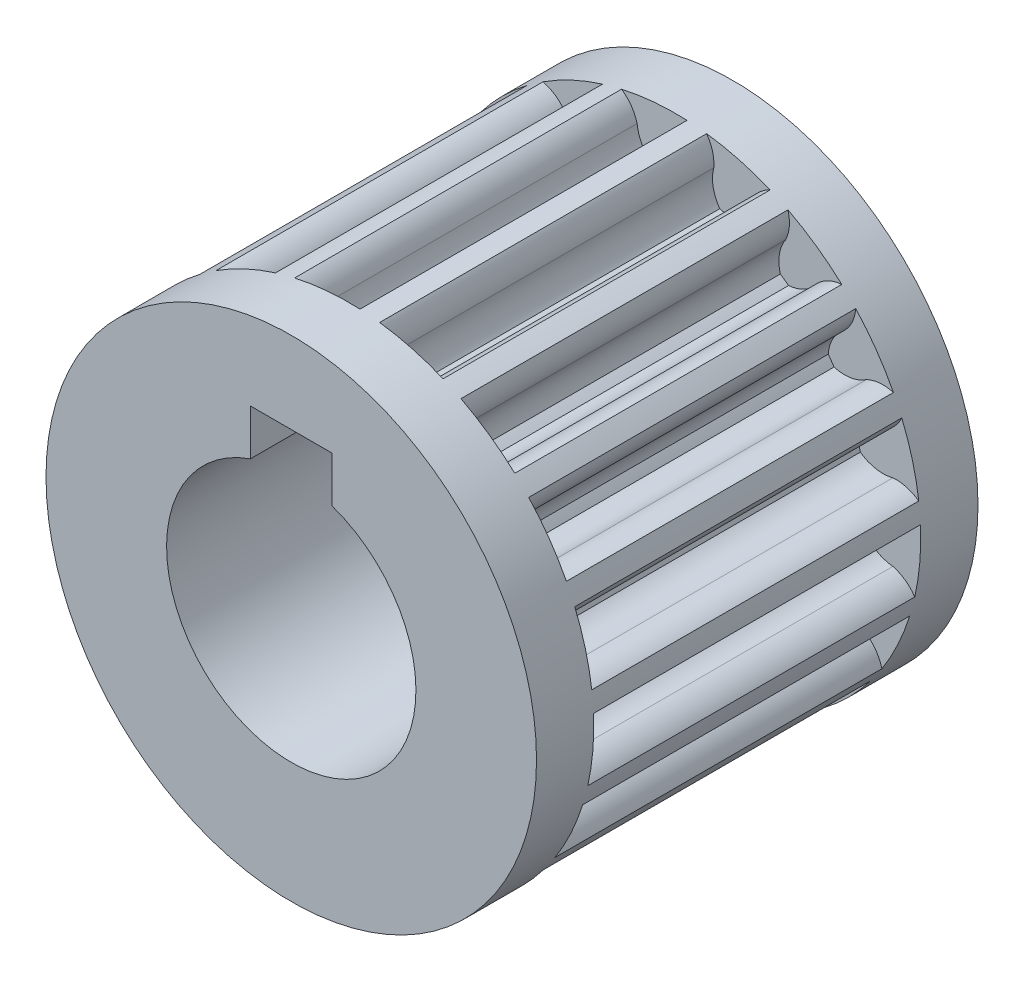
from build123d import *
from build123d.topology import SkipClean

# Parameters (mm, degrees)
CROQUIS1_R              = 15
SALIENTE_EXTRUIR1_DEPTH = 20
CORTAR_EXTRUIR1_START   = -50
CORTAR_EXTRUIR1_DEPTH   = 50
MATRIZC1_COUNT          = 18
CORTAR_EXTRUIR2_DEPTH   = 50
SALIENTE_EXTRUIR2_START = 3.5
CROQUIS4_R              = 15
SALIENTE_EXTRUIR2_DEPTH = 3.5
CROQUIS5_R              = 15
SALIENTE_EXTRUIR3_DEPTH = 3.5


with BuildPart() as part:
    # Croquis1 → Saliente-Extruir1 (new body)
    with BuildSketch(Plane.XY):
        Circle(CROQUIS1_R)
    extrude(amount=SALIENTE_EXTRUIR1_DEPTH)

    # Croquis2 → Cortar-Extruir1 (cut)
    with BuildSketch(Plane.XY.offset(20).offset(CORTAR_EXTRUIR1_START)):
        with BuildLine():
            ThreePointArc((0.706271711, -11.603525553), (0.13915994, -12.472075367), (0, -13.5))
            ThreePointArc((0, -13.5), (-0.21879275, -14.305081992), (-0.704430424, -14.983450129))
            ThreePointArc((-0.704430424, -14.983450129), (1.309, -14.942774809), (3.298836097, -14.632760519))
            ThreePointArc((3.298836097, -14.632760519), (2.702648979, -14.049161169), (2.347211067, -13.29438228))
            ThreePointArc((2.347211067, -13.29438228), (2.031447992, -12.306309297), (1.321961295, -11.549590613))
            ThreePointArc((1.321961295, -11.549590613), (1.014475, -11.580650477), (0.706271711, -11.603525553))
        make_face()
    cortar_extruir1 = extrude(amount=CORTAR_EXTRUIR1_DEPTH, mode=Mode.SUBTRACT)

    # MatrizC1: Cortar-Extruir1 ×18 about axis
    matrizc1_axis = Axis((0, 0, 20), (0, 0, 1))
    for i in range(1, MATRIZC1_COUNT):
        add(cortar_extruir1.rotate(matrizc1_axis, i * 360 / MATRIZC1_COUNT), mode=Mode.SUBTRACT)

    # Croquis3 → Cortar-Extruir2 (cut)
    with BuildSketch(Plane.XY.offset(20)):
        with BuildLine():
            Line((-2.5, 7.203514767), (-2.5, 10.005475737))
            Line((-2.5, 10.005475737), (2.5, 10.005475737))
            Line((2.5, 10.005475737), (2.5, 7.203514767))
            ThreePointArc((2.5, 7.203514767), (0, -7.625), (-2.5, 7.203514767))
        make_face()
    extrude(amount=-CORTAR_EXTRUIR2_DEPTH, mode=Mode.SUBTRACT)

    # Croquis4 → Saliente-Extruir2 (add)
    with SkipClean():  # the faces are left unmerged after this step: merging them gives an invalid solid
        with BuildSketch(Plane(origin=(0, 0, 0), x_dir=(-1, 0, 0), z_dir=(0, 0, -1)).offset(SALIENTE_EXTRUIR2_START)):
            Circle(CROQUIS4_R)
            with BuildLine():
                Line((2.5, 10.005475737), (2.5, 7.203514767))
                ThreePointArc((2.5, 7.203514767), (0, -7.625), (-2.5, 7.203514767))
                Line((-2.5, 7.203514767), (-2.5, 10.005475737))
                Line((-2.5, 10.005475737), (2.5, 10.005475737))
            make_face(mode=Mode.SUBTRACT)
        extrude(amount=-SALIENTE_EXTRUIR2_DEPTH)

    # Croquis5 → Saliente-Extruir3 (add)
    with BuildSketch(Plane.XY.offset(20)):
        Circle(CROQUIS5_R)
        with BuildLine():
            Line((2.5, 10.005475737), (2.5, 7.203514767))
            ThreePointArc((2.5, 7.203514767), (0, -7.625), (-2.5, 7.203514767))
            Line((-2.5, 7.203514767), (-2.5, 10.005475737))
            Line((-2.5, 10.005475737), (2.5, 10.005475737))
        make_face(mode=Mode.SUBTRACT)
    extrude(amount=SALIENTE_EXTRUIR3_DEPTH)


solid = part.part
